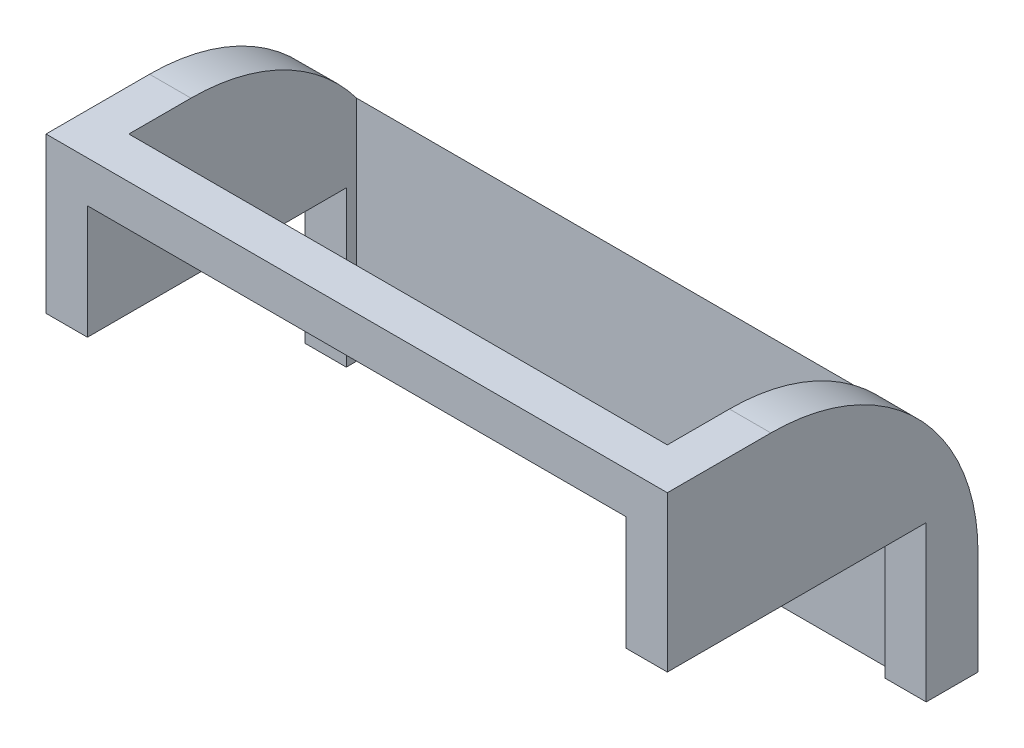
from build123d import *

# Parameters (mm, degrees)
SKETCH12_W               = 30
SKETCH12_H               = 15
BOSS_EXTRUDE4_DEPTH      = 15
FILLET1_R                = 10
CUT_EXTRUDE8_DEPTH       = 23.5
CUT_EXTRUDE8_DEPTH_BACK  = 23.5
SKETCH13_W               = 26
SKETCH13_H               = 11
SKETCH14_W               = 26
SKETCH14_H               = 11
CUT_EXTRUDE9_DEPTH       = 10
CUT_EXTRUDE10_DEPTH      = 35.369317712
CUT_EXTRUDE10_DEPTH_BACK = 35.369317712
SKETCH15_W               = 12.5
SKETCH15_H               = 7.5


with BuildPart() as part:
    # Sketch12 → Boss-Extrude4 (new body)
    with BuildSketch(Plane(origin=(0, 0, 0), x_dir=(1, 0, 0), z_dir=(0, 1, 0))):
        Rectangle(SKETCH12_W, SKETCH12_H)
    extrude(amount=BOSS_EXTRUDE4_DEPTH)

    # Fillet1
    fillet1_edges = [part.edges().sort_by_distance(p)[0] for p in [
        (0, 15, -7.5),
    ]]
    fillet(fillet1_edges, radius=FILLET1_R)

    # Sketch13 → Cut-Extrude8 (cut, two sides: drawn at the far end of the back side and taken through both)
    with BuildSketch(Plane.XZ.offset(-CUT_EXTRUDE8_DEPTH_BACK)):
        Rectangle(SKETCH13_W, SKETCH13_H)
    extrude(amount=CUT_EXTRUDE8_DEPTH + CUT_EXTRUDE8_DEPTH_BACK, mode=Mode.SUBTRACT)

    # Sketch14 → Cut-Extrude9 (cut)
    with BuildSketch(Plane.XY.offset(7.5)):
        with Locations((0, 7.5)):
            Rectangle(SKETCH14_W, SKETCH14_H)
    extrude(amount=-CUT_EXTRUDE9_DEPTH, mode=Mode.SUBTRACT)

    # Sketch15 → Cut-Extrude10 (cut, two sides: drawn at the far end of the back side and taken through both)
    with BuildSketch(Plane(origin=(15, 0, 0), x_dir=(0, 0, -1), z_dir=(1, 0, 0)).offset(-CUT_EXTRUDE10_DEPTH_BACK)):
        with Locations((-1.25, 3.75)):
            Rectangle(SKETCH15_W, SKETCH15_H)
    extrude(amount=CUT_EXTRUDE10_DEPTH + CUT_EXTRUDE10_DEPTH_BACK, mode=Mode.SUBTRACT)


solid = part.part
